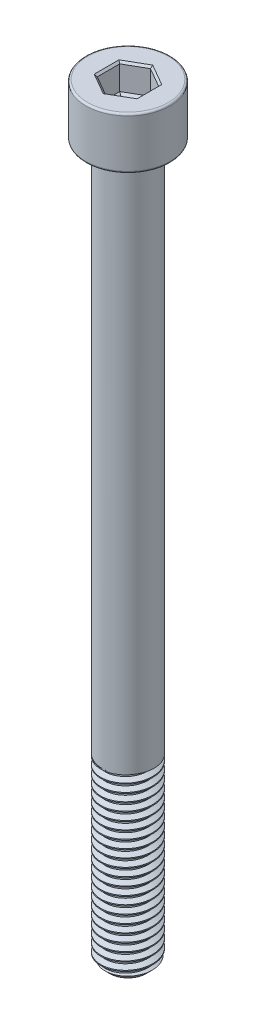
from build123d import *

# Parameters (mm, degrees)
SKETCH1_R           = 4
BOSS_EXTRUDE1_DEPTH = 28
THREAD1_PITCH       = 1.25
SKETCH2_R           = 4
BOSS_EXTRUDE2_DEPTH = 82
SKETCH5_R           = 6.5
BOSS_EXTRUDE3_DEPTH = 8
FILLET1_R           = 0.3
CUT_EXTRUDE1_DEPTH  = 4
CHAMFER1_SIZE       = 0.3
CUT_EXTRUDE2_DEPTH  = 0.4
CUT_EXTRUDE2_DRAFT  = -60


with BuildPart() as part:
    # Sketch1 → Boss-Extrude1 (new body)
    with BuildSketch(Plane(origin=(0, 0, 0), x_dir=(1, 0, 0), z_dir=(0, 1, 0))):
        with Locations(Location((0, 0, 0), (0, 0, 270))):
            Circle(SKETCH1_R)
    extrude(amount=BOSS_EXTRUDE1_DEPTH)

    # Thread1: the profile of Thread Profile1 profile screwed along a right-hand helix of 24 turns, 8 arcs to a turn; built about Z, then put on its axis
    thread1_z = Axis((0, 0, 0), (0, 0, 1))
    thread1_corners = [(4.0003, 0, -0.000173205), (4.0003, 0, 1.093923202), (3.323417656, 0, 0.703124998), (3.323417656, 0, 0.390624998)]
    with BuildLine(mode=Mode.PRIVATE) as thread1_profile:
        Line(thread1_corners[0], thread1_corners[1])
        Line(thread1_corners[1], thread1_corners[2])
        Line(thread1_corners[2], thread1_corners[3])
        Line(thread1_corners[3], thread1_corners[0])
    thread1_cap = Face(thread1_profile.wire())
    thread1_turn_angles = [0, 22.5, 45, 67.5, 90, 112.5, 135, 157.5, 180, 202.5, 225, 247.5, 270, 292.5, 315, 337.5, 360]
    thread1_turn_weights = [1, 0.9238795325112867, 1, 0.9238795325112867, 1, 0.9238795325112867, 1, 0.9238795325112867, 1, 0.9238795325112867, 1, 0.9238795325112867, 1, 0.9238795325112867, 1, 0.9238795325112867, 1]
    thread1_turn_rails = [Edge.make_bspline([Vector(p[0], p[1], 0).rotate(thread1_z, thread1_turn_angles[k]) / thread1_turn_weights[k] + Vector(0, 0, p[2] + THREAD1_PITCH * thread1_turn_angles[k] / 360) for k in range(17)], [0, 0, 0, 1, 1, 2, 2, 3, 3, 4, 4, 5, 5, 6, 6, 7, 7, 8, 8, 8], 2, thread1_turn_weights) for p in thread1_corners]
    thread1_turn_sides = [Face.make_surface_from_curves(thread1_turn_rails[p[0]], thread1_turn_rails[p[1]]) for p in [(0, 1), (1, 2), (2, 3), (3, 0)]]
    thread1 = Plane(origin=(0, 30, 0), x_dir=(-1, 0, 0), z_dir=(0, -1, 0)) * Solid(Shell([*[p.moved(Location((0, 0, THREAD1_PITCH * i))) for i in range(24) for p in thread1_turn_sides], thread1_cap, thread1_cap.rotate(thread1_z, 8640).moved(Location((0, 0, THREAD1_PITCH * 8640 / 360)))]))
    add(thread1, mode=Mode.SUBTRACT)

    # Sketch2 → Boss-Extrude2 (add)
    with BuildSketch(Plane(origin=(0, 28, 0), x_dir=(1, 0, 0), z_dir=(0, 1, 0))):
        with Locations(Location((0, 0, 0), (0, 0, 117.593571361))):
            Circle(SKETCH2_R)
    extrude(amount=BOSS_EXTRUDE2_DEPTH)

    # Sketch5 → Boss-Extrude3 (add)
    with BuildSketch(Plane(origin=(0, 110, 0), x_dir=(1, 0, 0), z_dir=(0, 1, 0))):
        with Locations(Location((0, 0, 0), (0, 0, 270))):
            Circle(SKETCH5_R)
    extrude(amount=BOSS_EXTRUDE3_DEPTH)

    # Sketch6 → Cut-Revolve1 (revolve, cut)
    with BuildSketch(Plane.XY, mode=Mode.PRIVATE) as cut_revolve1_sk:
        Polygon((4.01, 0), (4.01, 1.2), (2.81, 0), align=None)
    revolve(cut_revolve1_sk.sketch.rotate(Axis((0, 0, 0), (0, 1, 0)), 117.593571361), axis=Axis((0, 0, 0), (0, 1, 0)), mode=Mode.SUBTRACT)

    # Fillet1
    fillet1_edges = [part.edges().sort_by_distance(p)[0] for p in [
        (0, 110, -6.5),
        (0, 118, -6.5),
    ]]
    fillet(fillet1_edges, radius=FILLET1_R)

    # Sketch7 → Cut-Extrude1 (cut)
    with BuildSketch(Plane(origin=(0, 118, 0), x_dir=(1, 0, 0), z_dir=(0, 1, 0))):
        Polygon((0, 3.464101615), (-3, 1.732050808), (-3, -1.732050808), (0, -3.464101615), (3, -1.732050808), (3, 1.732050808), align=None)
    extrude(amount=-CUT_EXTRUDE1_DEPTH, mode=Mode.SUBTRACT)

    # Chamfer1
    chamfer1_edges = [part.edges().sort_by_distance(p)[0] for p in [
        (1.5, 118, -2.598076211),
        (-1.5, 118, -2.598076211),
        (-3, 118, 0),
        (-1.5, 118, 2.598076211),
        (1.5, 118, 2.598076211),
        (3, 118, 0),
    ]]
    chamfer(chamfer1_edges, length=CHAMFER1_SIZE)


with BuildPart() as cut_extrude2_tool:
    # Sketch8 → Cut-Extrude2 (with draft: the straight prism first)
    with BuildSketch(Plane(origin=(0, 114, 0), x_dir=(1, 0, 0), z_dir=(0, 1, 0))):
        Polygon((0, 3.464101615), (-3, 1.732050808), (-3, -1.732050808), (0, -3.464101615), (3, -1.732050808), (3, 1.732050808), align=None)
    extrude(amount=-CUT_EXTRUDE2_DEPTH)
    # Cut-Extrude2: the draft: its side faces are tilted about the plane it starts from
    cut_extrude2_sides = [cut_extrude2_tool.faces().sort_by_distance(p)[0] for p in [
        (-1.5, 113.8, -2.598076211),
        (-3, 113.8, 0),
        (-1.5, 113.8, 2.598076211),
        (1.5, 113.8, 2.598076211),
        (3, 113.8, 0),
        (1.5, 113.8, -2.598076211),
    ]]
    draft(cut_extrude2_sides, Plane(origin=(0, 114, 0), x_dir=(1, 0, 0), z_dir=(0, 1, 0)), CUT_EXTRUDE2_DRAFT)


with BuildPart() as part_1:
    add(part.part)

    # Cut-Extrude2: cut by cut_extrude2_tool
    add(cut_extrude2_tool.part, mode=Mode.SUBTRACT)


solid = part_1.part
